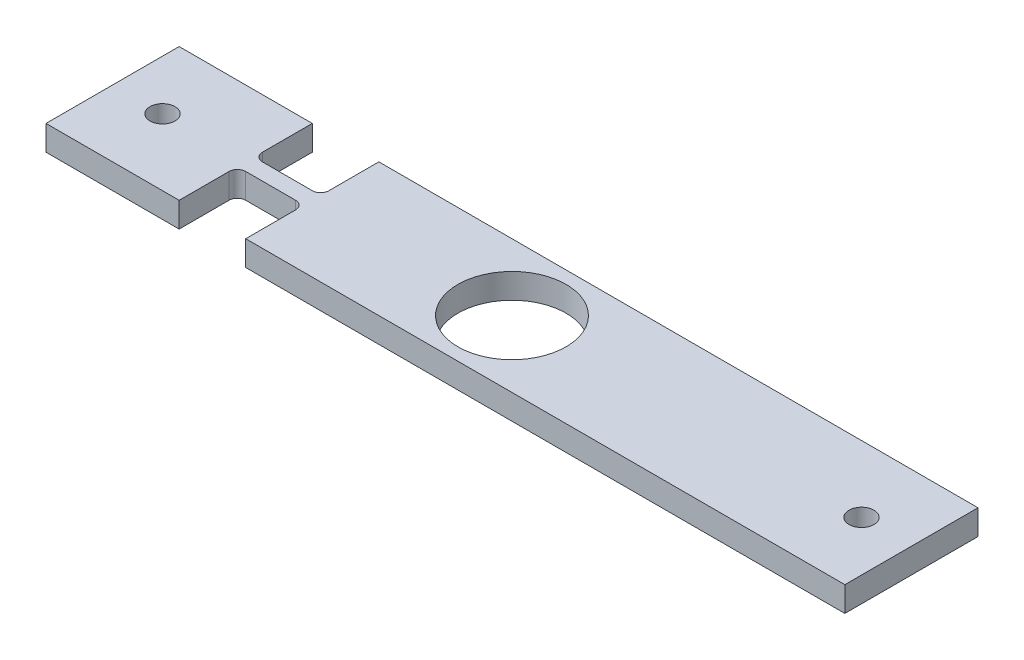
from build123d import *

# Parameters (mm, degrees)
SKETCH1_W           = 304.8
SKETCH1_H           = 50.8
BOSS_EXTRUDE1_DEPTH = 9.525
SKETCH2_R           = 20.6375
CUT_EXTRUDE1_DEPTH  = 155.795496139
SKETCH3_R           = 4.7625
CUT_EXTRUDE2_DEPTH  = 155.795496139
CUT_EXTRUDE3_DEPTH  = 155.795496139
SKETCH5_R           = 4.7625
CUT_EXTRUDE4_DEPTH  = 155.795496139


with BuildPart() as part:
    # Sketch1 → Boss-Extrude1 (new body)
    with BuildSketch(Plane(origin=(0, 0, 0), x_dir=(1, 0, 0), z_dir=(0, 1, 0))):
        Rectangle(SKETCH1_W, SKETCH1_H)
    extrude(amount=BOSS_EXTRUDE1_DEPTH)

    # Sketch2 → Cut-Extrude1 (cut, through all)
    with BuildSketch(Plane(origin=(0, 9.525, 0), x_dir=(1, 0, 0), z_dir=(0, 1, 0))):
        Circle(SKETCH2_R)
    extrude(amount=-CUT_EXTRUDE1_DEPTH, mode=Mode.SUBTRACT)

    # Sketch3 → Cut-Extrude2 (cut, through all)
    with BuildSketch(Plane(origin=(0, 9.525, 0), x_dir=(1, 0, 0), z_dir=(0, 1, 0))):
        with Locations((133.35, 0)):
            Circle(SKETCH3_R)
    extrude(amount=-CUT_EXTRUDE2_DEPTH, mode=Mode.SUBTRACT)

    # Sketch4 → Cut-Extrude3 (cut, through all)
    with BuildSketch(Plane(origin=(0, 9.525, 0), x_dir=(1, 0, 0), z_dir=(0, 1, 0))):
        with BuildLine():
            Line((-101.6, 25.4), (-76.2, 25.4))
            Line((-76.2, 25.4), (-76.2, 6.35))
            ThreePointArc((-76.2, 6.35), (-77.12993597, 4.10493597), (-79.375, 3.175))
            Line((-79.375, 3.175), (-98.425, 3.175))
            ThreePointArc((-98.425, 3.175), (-100.67006403, 4.10493597), (-101.6, 6.35))
            Line((-101.6, 6.35), (-101.6, 25.4))
        make_face()
        with BuildLine():
            Line((-101.6, -25.4), (-76.2, -25.4))
            Line((-76.2, -25.4), (-76.2, -6.35))
            ThreePointArc((-76.2, -6.35), (-77.12993597, -4.10493597), (-79.375, -3.175))
            Line((-79.375, -3.175), (-98.425, -3.175))
            ThreePointArc((-98.425, -3.175), (-100.67006403, -4.10493597), (-101.6, -6.35))
            Line((-101.6, -6.35), (-101.6, -25.4))
        make_face()
    extrude(amount=-CUT_EXTRUDE3_DEPTH, mode=Mode.SUBTRACT)

    # Sketch5 → Cut-Extrude4 (cut, through all)
    with BuildSketch(Plane(origin=(0, 9.525, 0), x_dir=(1, 0, 0), z_dir=(0, 1, 0))):
        with Locations((-133.35, 0)):
            Circle(SKETCH5_R)
    extrude(amount=-CUT_EXTRUDE4_DEPTH, mode=Mode.SUBTRACT)


solid = part.part
